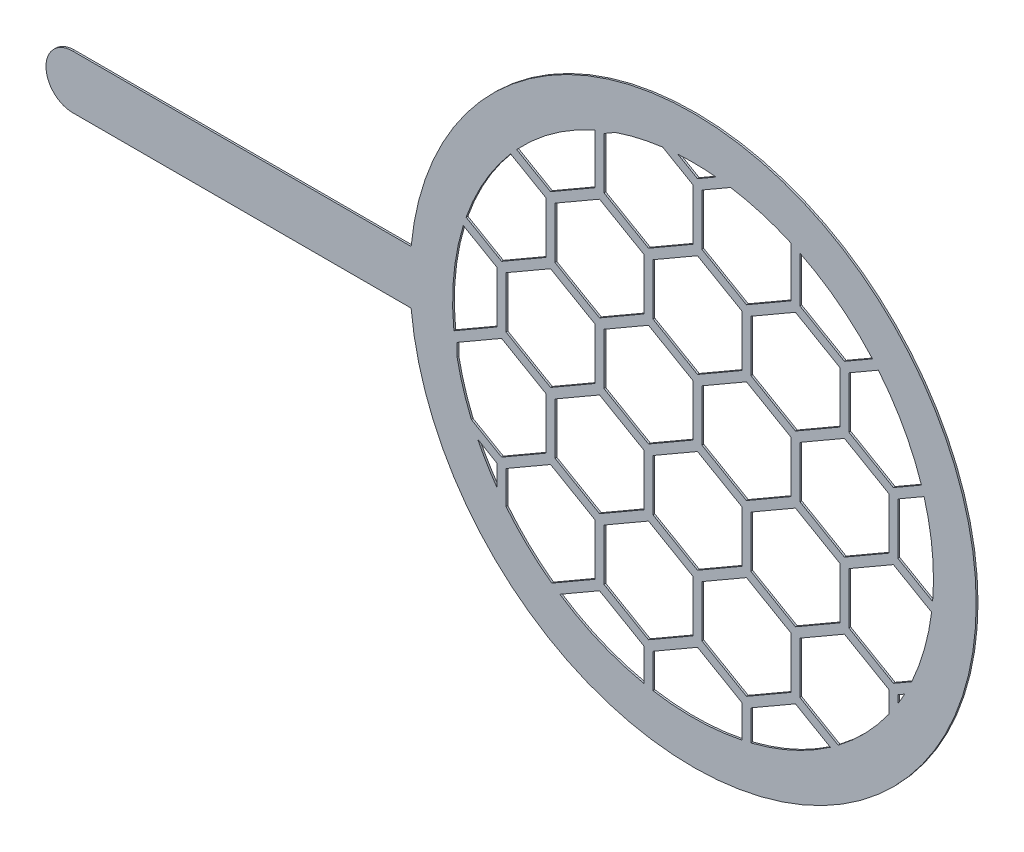
from build123d import *

# Parameters (mm, degrees)
BOSS_EXTRU_1_DEPTH = 0.1
BOSS_EXTRU_2_START = -0.1
ESQUISSE2_R        = 15.9
ESQUISSE2_R_2      = 13.5
BOSS_EXTRU_2_DEPTH = 0.1
ESQUISSE3_W        = 19
ESQUISSE3_H        = 3
BOSS_EXTRU_3_DEPTH = 0.1
BOSS_EXTRU_4_DEPTH = 0.1


with BuildPart() as part:
    # Esquisse1 → Boss.-Extru.1 (new body)
    with BuildSketch(Plane.XY):
        with BuildLine():
            Line((8, 10.963375673), (8, 9.770386406))
            ThreePointArc((8, 9.770386406), (8.244950741, 9.437033931), (8.5, 9.111342953))
            Line((8.5, 9.111342953), (8.5, 10.963375673))
            Line((8.5, 10.963375673), (11, 12.406751346))
            Line((11, 12.406751346), (13.5, 10.963375673))
            Line((13.5, 10.963375673), (13.5, 8.076624327))
            Line((13.5, 8.076624327), (11.068102929, 6.672567898))
            ThreePointArc((11.068102929, 6.672567898), (11.293320321, 6.512532649), (11.521765602, 6.357139896))
            Line((11.521765602, 6.357139896), (13.75, 7.643611625))
            Line((13.75, 7.643611625), (16.25, 6.200235952))
            Line((16.25, 6.200235952), (16.25, 4.379684439))
            ThreePointArc((16.25, 4.379684439), (16.499555984, 4.330208846), (16.75, 4.285444815))
            Line((16.75, 4.285444815), (16.75, 6.200235952))
            Line((16.75, 6.200235952), (19.25, 7.643611625))
            Line((19.25, 7.643611625), (21.75, 6.200235952))
            Line((21.75, 6.200235952), (21.75, 4.379684439))
            ThreePointArc((21.75, 4.379684439), (22.000541282, 4.434301127), (22.25, 4.493666646))
            Line((22.25, 4.493666646), (22.25, 6.200235952))
            Line((22.25, 6.200235952), (24.75, 7.643611625))
            Line((24.75, 7.643611625), (26.70777139, 6.513291786))
            ThreePointArc((26.70777139, 6.513291786), (26.930896292, 6.671841308), (27.150760816, 6.834881991))
            Line((27.150760816, 6.834881991), (25, 8.076624327))
            Line((25, 8.076624327), (25, 10.963375673))
            Line((25, 10.963375673), (27.5, 12.406751346))
            Line((27.5, 12.406751346), (30, 10.963375673))
            Line((30, 10.963375673), (30, 9.770386406))
            ThreePointArc((30, 9.770386406), (30.256334682, 10.143777252), (30.5, 10.525556515))
            Line((30.5, 10.525556515), (30.5, 10.963375673))
            Line((30.5, 10.963375673), (30.878658093, 11.181994025))
            ThreePointArc((30.878658093, 11.181994025), (31.084835516, 11.579419781), (31.277720856, 11.983463846))
            Line((31.277720856, 11.983463846), (30.25, 11.390108933))
            Line((30.25, 11.390108933), (27.75, 12.833484606))
            Line((27.75, 12.833484606), (27.75, 15.720235952))
            Line((27.75, 15.720235952), (30.25, 17.163611625))
            Line((30.25, 17.163611625), (32.396054962, 15.924586215))
            ThreePointArc((32.396054962, 15.924586215), (32.427206768, 16.196582041), (32.452836499, 16.469153649))
            Line((32.452836499, 16.469153649), (30.5, 17.596624327))
            Line((30.5, 17.596624327), (30.5, 20.483375673))
            Line((30.5, 20.483375673), (31.972494217, 21.333520605))
            ThreePointArc((31.972494217, 21.333520605), (31.899995998, 21.576587048), (31.822943865, 21.818248497))
            Line((31.822943865, 21.818248497), (30.25, 20.910108933))
            Line((30.25, 20.910108933), (27.75, 22.353484606))
            Line((27.75, 22.353484606), (27.75, 25.240235952))
            Line((27.75, 25.240235952), (29.406333765, 26.196520697))
            ThreePointArc((29.406333765, 26.196520697), (29.242437238, 26.391081639), (29.074903676, 26.582519715))
            Line((29.074903676, 26.582519715), (27.5, 25.673248654))
            Line((27.5, 25.673248654), (25, 27.116624327))
            Line((25, 27.116624327), (25, 29.690010949))
            ThreePointArc((25, 29.690010949), (24.751204931, 29.810290519), (24.5, 29.925452333))
            Line((24.5, 29.925452333), (24.5, 27.116624327))
            Line((24.5, 27.116624327), (22, 25.673248654))
            Line((22, 25.673248654), (19.5, 27.116624327))
            Line((19.5, 27.116624327), (19.5, 30.003375673))
            Line((19.5, 30.003375673), (21.107012299, 30.931184656))
            ThreePointArc((21.107012299, 30.931184656), (20.702475279, 30.988845126), (20.296378476, 31.034235828))
            Line((20.296378476, 31.034235828), (19.25, 30.430108933))
            Line((19.25, 30.430108933), (18.14275136, 31.069379233))
            ThreePointArc((18.14275136, 31.069379233), (17.717692527, 31.035585877), (17.293912954, 30.988385488))
            Line((17.293912954, 30.988385488), (19, 30.003375673))
            Line((19, 30.003375673), (19, 27.116624327))
            Line((19, 27.116624327), (16.5, 25.673248654))
            Line((16.5, 25.673248654), (14, 27.116624327))
            Line((14, 27.116624327), (14, 30.003375673))
            Line((14, 30.003375673), (14.641275167, 30.373616063))
            ThreePointArc((14.641275167, 30.373616063), (14.065546989, 30.162497694), (13.5, 29.925452333))
            Line((13.5, 29.925452333), (13.5, 27.116624327))
            Line((13.5, 27.116624327), (11, 25.673248654))
            Line((11, 25.673248654), (9.097195417, 26.771833392))
            ThreePointArc((9.097195417, 26.771833392), (8.925430146, 26.582893979), (8.757269133, 26.390739654))
            Line((8.757269133, 26.390739654), (10.75, 25.240235952))
            Line((10.75, 25.240235952), (10.75, 22.353484606))
            Line((10.75, 22.353484606), (8.25, 20.910108933))
            Line((8.25, 20.910108933), (6.259044124, 22.059587844))
            ThreePointArc((6.259044124, 22.059587844), (6.177770926, 21.820419016), (6.100986885, 21.579771406))
            Line((6.100986885, 21.579771406), (8, 20.483375673))
            Line((8, 20.483375673), (8, 17.596624327))
            Line((8, 17.596624327), (5.572921748, 16.195350045))
            ThreePointArc((5.572921748, 16.195350045), (5.648313527, 15.601012061), (5.75, 15.010604219))
            Line((5.75, 15.010604219), (5.75, 15.720235952))
            Line((5.75, 15.720235952), (8.25, 17.163611625))
            Line((8.25, 17.163611625), (10.75, 15.720235952))
            Line((10.75, 15.720235952), (10.75, 12.833484606))
            Line((10.75, 12.833484606), (8.25, 11.390108933))
            Line((8.25, 11.390108933), (6.55282742, 12.369971979))
            ThreePointArc((6.55282742, 12.369971979), (6.724274299, 11.979101873), (6.90799175, 11.59384693))
            Line((6.90799175, 11.59384693), (8, 10.963375673))
        make_face()
        Polygon((19, 10.963375673), (19, 8.076624327), (16.5, 6.633248654), (14, 8.076624327), (14, 10.963375673), (16.5, 12.406751346), align=None, mode=Mode.SUBTRACT)
        Polygon((16.25, 15.720235952), (16.25, 12.833484606), (13.75, 11.390108933), (11.25, 12.833484606), (11.25, 15.720235952), (13.75, 17.163611625), align=None, mode=Mode.SUBTRACT)
        Polygon((21.75, 15.720235952), (21.75, 12.833484606), (19.25, 11.390108933), (16.75, 12.833484606), (16.75, 15.720235952), (19.25, 17.163611625), align=None, mode=Mode.SUBTRACT)
        Polygon((24.5, 10.963375673), (24.5, 8.076624327), (22, 6.633248654), (19.5, 8.076624327), (19.5, 10.963375673), (22, 12.406751346), align=None, mode=Mode.SUBTRACT)
        Polygon((27.25, 15.720235952), (27.25, 12.833484606), (24.75, 11.390108933), (22.25, 12.833484606), (22.25, 15.720235952), (24.75, 17.163611625), align=None, mode=Mode.SUBTRACT)
        Polygon((13.5, 20.483375673), (13.5, 17.596624327), (11, 16.153248654), (8.5, 17.596624327), (8.5, 20.483375673), (11, 21.926751346), align=None, mode=Mode.SUBTRACT)
        Polygon((19, 20.483375673), (19, 17.596624327), (16.5, 16.153248654), (14, 17.596624327), (14, 20.483375673), (16.5, 21.926751346), align=None, mode=Mode.SUBTRACT)
        Polygon((16.25, 25.240235952), (16.25, 22.353484606), (13.75, 20.910108933), (11.25, 22.353484606), (11.25, 25.240235952), (13.75, 26.683611625), align=None, mode=Mode.SUBTRACT)
        Polygon((21.75, 25.240235952), (21.75, 22.353484606), (19.25, 20.910108933), (16.75, 22.353484606), (16.75, 25.240235952), (19.25, 26.683611625), align=None, mode=Mode.SUBTRACT)
        Polygon((24.5, 20.483375673), (24.5, 17.596624327), (22, 16.153248654), (19.5, 17.596624327), (19.5, 20.483375673), (22, 21.926751346), align=None, mode=Mode.SUBTRACT)
        Polygon((30, 20.483375673), (30, 17.596624327), (27.5, 16.153248654), (25, 17.596624327), (25, 20.483375673), (27.5, 21.926751346), align=None, mode=Mode.SUBTRACT)
        Polygon((27.25, 25.240235952), (27.25, 22.353484606), (24.75, 20.910108933), (22.25, 22.353484606), (22.25, 25.240235952), (24.75, 26.683611625), align=None, mode=Mode.SUBTRACT)
    extrude(amount=BOSS_EXTRU_1_DEPTH)

    # Esquisse2 → Boss.-Extru.2 (add)
    with BuildSketch(Plane.XY.offset(0.1).offset(BOSS_EXTRU_2_START)):
        with Locations((19, 17.596624327)):
            Circle(ESQUISSE2_R)
        with Locations((19, 17.596624327)):
            Circle(ESQUISSE2_R_2, mode=Mode.SUBTRACT)
    extrude(amount=BOSS_EXTRU_2_DEPTH)

    # Esquisse3 → Boss.-Extru.3 (add)
    with BuildSketch(Plane.XY.offset(0.1)):
        with Locations((-6.32908715, 17.596624327)):
            Rectangle(ESQUISSE3_W, ESQUISSE3_H)
    extrude(amount=-BOSS_EXTRU_3_DEPTH)

    # Esquisse4 → Boss.-Extru.4 (add)
    with BuildSketch(Plane.XY.offset(0.1)):
        with BuildLine():
            Line((-15.82908715, 19.096624327), (-15.82908715, 16.096624327))
            ThreePointArc((-15.82908715, 16.096624327), (-17.32908715, 17.596624327), (-15.82908715, 19.096624327))
        make_face()
    extrude(amount=-BOSS_EXTRU_4_DEPTH)


solid = part.part
